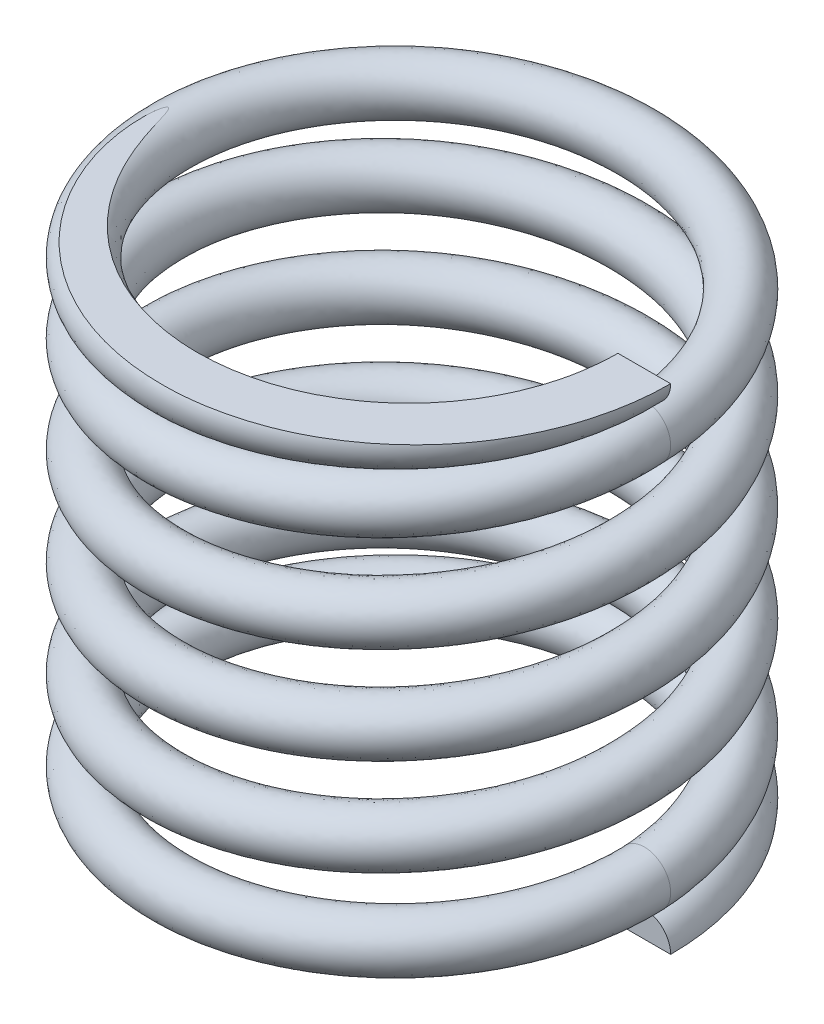
from build123d import *

# Parameters (mm, degrees)
SWEEP1_PITCH       = 2.9372
SWEEP1_HEIGHT      = 11.7488
SWEEP1_RADIUS      = 7.85
SWEEP1_START_ANGLE = 90
SKETCH1_R          = 0.8001
SWEEP2_PITCH       = 1.6256
SWEEP2_HEIGHT      = 1.6256
SWEEP2_RADIUS      = 7.85
SWEEP2_START_ANGLE = 90
SKETCH5_R          = 0.8001
SWEEP3_PITCH       = 1.6256
SWEEP3_HEIGHT      = 1.6256
SWEEP3_RADIUS      = 7.85
SWEEP3_START_ANGLE = 90
SKETCH7_R          = 0.8001
SKETCH8_W          = 7.85
SKETCH8_H          = 0.8001


with BuildPart() as part:
    # Sweep1: sweep along a helix
    with BuildLine() as sweep1_path:
        add(Helix(SWEEP1_PITCH, SWEEP1_HEIGHT, SWEEP1_RADIUS, center=(0, 1.6256, 0), direction=(0, 1, 0), mode=Mode.PRIVATE).rotate(Axis((0, 1.6256, 0), (0, 1, 0)), SWEEP1_START_ANGLE))
    # Sketch1 → Sweep1 (sweep)
    with BuildSketch(Plane.XY):
        with Locations((7.0499, 1.6256)):
            Circle(SKETCH1_R)
    sweep(path=sweep1_path.line, is_frenet=True)

    # Sweep2: sweep along a helix
    with BuildLine() as sweep2_path:
        add(Helix(SWEEP2_PITCH, SWEEP2_HEIGHT, SWEEP2_RADIUS, center=(0, 1.6256, 0), direction=(0, -1, 0), mode=Mode.PRIVATE).rotate(Axis((0, 1.6256, 0), (0, -1, 0)), SWEEP2_START_ANGLE))
    # Sketch5 → Sweep2 (sweep)
    with BuildSketch(Plane.XY):
        with Locations((7.0499, 0)):
            Circle(SKETCH5_R)
    sweep(path=sweep2_path.line, is_frenet=True)

    # Sweep3: sweep along a helix
    with BuildLine() as sweep3_path:
        add(Helix(SWEEP3_PITCH, SWEEP3_HEIGHT, SWEEP3_RADIUS, center=(0, 13.3744, 0), direction=(0, 1, 0), mode=Mode.PRIVATE).rotate(Axis((0, 13.3744, 0), (0, 1, 0)), SWEEP3_START_ANGLE))
    # Sketch7 → Sweep3 (sweep)
    with BuildSketch(Plane.XY):
        with Locations((7.0499, 13.3744)):
            Circle(SKETCH7_R)
    sweep(path=sweep3_path.line, is_frenet=True)

    # Sketch8 → Cut-Revolve1 (revolve, cut)
    with BuildSketch(Plane.XY):
        with Locations((3.925, 15.40005)):
            Rectangle(SKETCH8_W, SKETCH8_H)
        with Locations((3.925, -0.40005)):
            Rectangle(SKETCH8_W, SKETCH8_H)
    revolve(axis=Axis((0, 0, 0), (0, 1, 0)), mode=Mode.SUBTRACT)


solid = part.part
